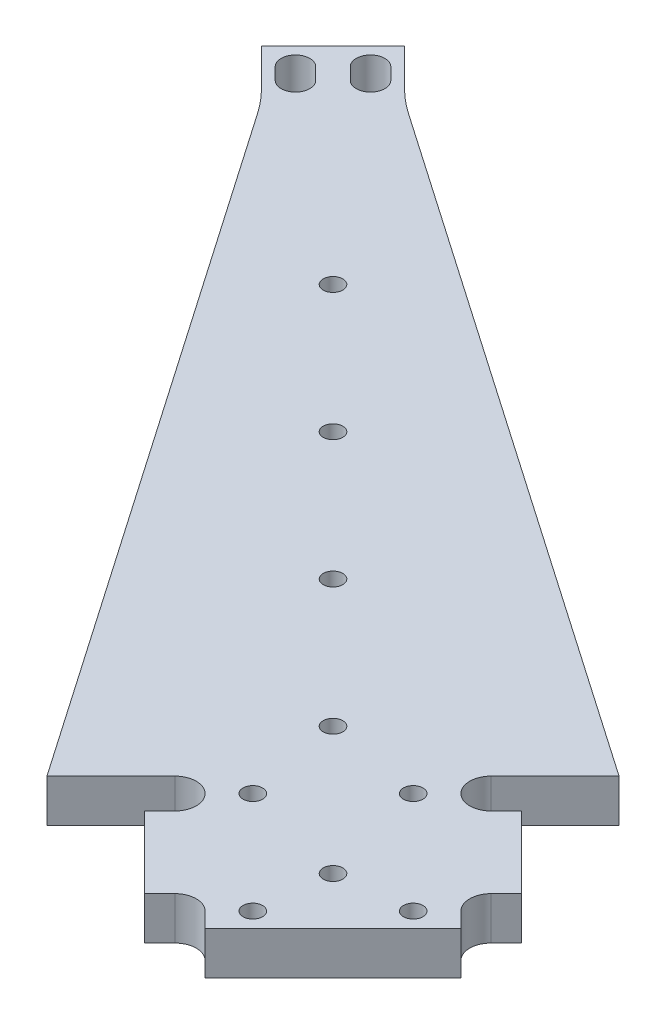
from build123d import *

# Parameters (mm, degrees)
BOSS_EXTRUDE1_DEPTH    = 3.175
FILLET1_R              = 25
M2_5_CLEARANCE_HOLE1_D = 2.9
FILLET2_R              = 3.175


with BuildPart() as part:
    # Sketch1 → Boss-Extrude1 (new, symmetric)
    with BuildSketch(Plane(origin=(0, 0, 0), x_dir=(1, 0, 0), z_dir=(0, 1, 0))):
        Polygon((12.993087104, -2.386485387), (2.386485387, -12.993087104), (9.457553198, -20.064154916), (80.256619665, -122.683026536), (91.985753398, -110.953892803), (96.475881458, -115.444020863), (91.985753398, -119.934148924), (102.592355115, -130.540750642), (107.082483176, -126.050622581), (111.572611236, -130.540750642), (130.540750642, -111.572611236), (126.050622581, -107.082483176), (130.540750642, -102.592355115), (119.934148924, -91.985753398), (115.444020863, -96.475881458), (110.953892803, -91.985753398), (122.683026536, -80.256619665), (20.064154916, -9.457553198), align=None)
        with BuildLine():
            Line((9.060159187, -11.622714162), (10.82792614, -13.390481115))
            ThreePointArc((10.82792614, -13.390481115), (10.82792614, -16.395684935), (7.82272232, -16.395684935))
            Line((7.82272232, -16.395684935), (6.054955367, -14.627917982))
            ThreePointArc((6.054955367, -14.627917982), (6.054955367, -11.622714162), (9.060159187, -11.622714162))
        make_face(mode=Mode.SUBTRACT)
        with BuildLine():
            Line((14.627917982, -6.054955367), (16.395684935, -7.82272232))
            ThreePointArc((16.395684935, -7.82272232), (16.395684935, -10.82792614), (13.390481115, -10.82792614))
            Line((13.390481115, -10.82792614), (11.622714162, -9.060159187))
            ThreePointArc((11.622714162, -9.060159187), (11.622714162, -6.054955367), (14.627917982, -6.054955367))
        make_face(mode=Mode.SUBTRACT)
    extrude(amount=BOSS_EXTRUDE1_DEPTH, both=True)

    # Fillet1
    fillet1_edges = [part.edges().sort_by_distance(p)[0] for p in [
        (9.457553198, 0, 20.064154916),
        (20.064154916, 0, 9.457553198),
    ]]
    fillet(fillet1_edges, radius=FILLET1_R)

    # M2.5 Clearance Hole1 (through all)
    with Locations(Plane(origin=(0, 3.175, 0), x_dir=(1, 0, 0), z_dir=(0, 1, 0))):
        with Locations((97.766351334, -109.663422927), (109.663422927, -97.766351334), (112.863081112, -124.760152706), (124.760152706, -112.863081112), (38.32518754, -38.32518754), (57.240293937, -57.240293937), (76.155400334, -76.155400334), (95.070506731, -95.070506731), (113.985613127, -113.985613127)):
            Hole(M2_5_CLEARANCE_HOLE1_D / 2)

    # Fillet2
    fillet2_edges = [part.edges().sort_by_distance(p)[0] for p in [
        (110.953892803, 0, 91.985753398),
        (115.444020863, 0, 96.475881458),
        (126.050622581, 0, 107.082483176),
        (107.082483176, 0, 126.050622581),
        (96.475881458, 0, 115.444020863),
        (91.985753398, 0, 110.953892803),
    ]]
    fillet(fillet2_edges, radius=FILLET2_R - 0.0001)  # a hair under: the kernel refuses the full size


solid = part.part
